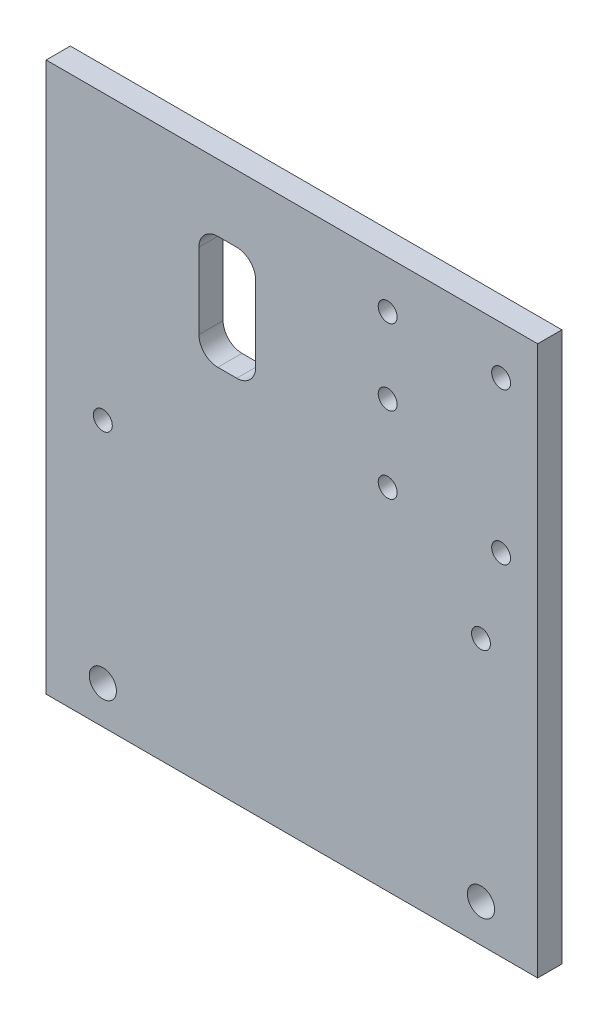
from build123d import *

# Parameters (mm, degrees)
SKETCH1_W           = 130
SKETCH1_H           = 145.26
SKETCH1_R           = 3.6
SKETCH1_R_2         = 2.5
BOSS_EXTRUDE1_DEPTH = 6.4
SKETCH2_W           = 15
SKETCH2_H           = 30
CUT_EXTRUDE1_DEPTH  = 178.654798978
FILLET1_R           = 5


with BuildPart() as part:
    # Sketch1 → Boss-Extrude1 (new body)
    with BuildSketch(Plane.XY):
        with Locations((50, 62.63)):
            Rectangle(SKETCH1_W, SKETCH1_H)
        Circle(SKETCH1_R, mode=Mode.SUBTRACT)
        with Locations((0, 60.26)):
            Circle(SKETCH1_R_2, mode=Mode.SUBTRACT)
        with Locations((100, 60.26)):
            Circle(SKETCH1_R_2, mode=Mode.SUBTRACT)
        with Locations((100, 0)):
            Circle(SKETCH1_R, mode=Mode.SUBTRACT)
        with Locations((75.33, 82.555)):
            Circle(SKETCH1_R_2, mode=Mode.SUBTRACT)
        with Locations((105.33, 82.555)):
            Circle(SKETCH1_R_2, mode=Mode.SUBTRACT)
        with Locations((105.33, 122.635)):
            Circle(SKETCH1_R_2, mode=Mode.SUBTRACT)
        with Locations((75.33, 102.766411568)):
            Circle(SKETCH1_R_2, mode=Mode.SUBTRACT)
        with Locations((75.33, 122.766411568)):
            Circle(SKETCH1_R_2, mode=Mode.SUBTRACT)
    extrude(amount=BOSS_EXTRUDE1_DEPTH)

    # Sketch2 → Cut-Extrude1 (cut, through all)
    with BuildSketch(Plane(origin=(0, 0, 0), x_dir=(-1, 0, 0), z_dir=(0, 0, -1))):
        with Locations((-32.90754614, 102.570367495)):
            Rectangle(SKETCH2_W, SKETCH2_H)
    extrude(amount=-CUT_EXTRUDE1_DEPTH, mode=Mode.SUBTRACT)

    # Fillet1
    fillet1_edges = [part.edges().sort_by_distance(p)[0] for p in [
        (25.40754614, 117.570367495, 3.2),
        (40.40754614, 117.570367495, 3.2),
        (25.40754614, 87.570367495, 3.2),
        (40.40754614, 87.570367495, 3.2),
    ]]
    fillet(fillet1_edges, radius=FILLET1_R)


solid = part.part
